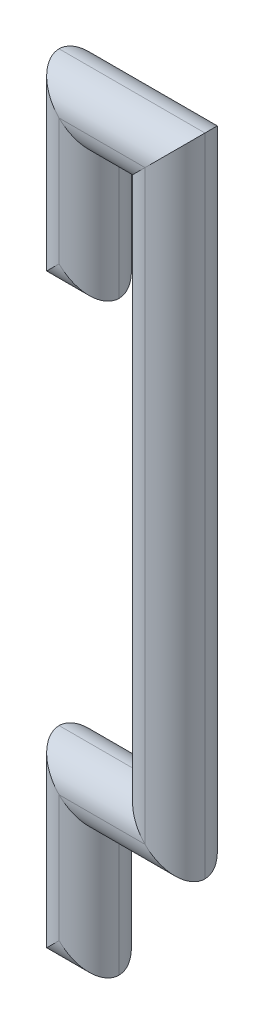
from build123d import *

# Parameters (mm, degrees)
EXTRU_MINCE1_DEPTH = 2.3
CONG_1_R           = 2.3


with BuildPart() as part:
    # Esquisse1 → Extru.-Mince1 (new, symmetric)
    with BuildSketch(Plane.XY):
        Polygon((-4.3, -57), (-4.3, -47.3), (2.3, -47.3), (2.3, 2.3), (-8.9, 2.3), (-8.9, -12), (-4.3, -12), (-4.3, -2.3), (-2.3, -2.3), (-2.3, -42.7), (-8.9, -42.7), (-8.9, -57), align=None)
    extrude(amount=EXTRU_MINCE1_DEPTH, both=True)

    # Congé1
    cong_1_edges = [part.edges().sort_by_distance(p)[0] for p in [
        (-6.6, -57, -2.3),
        (-4.3, -52.15, -2.3),
        (-1, -47.3, -2.3),
        (2.3, -22.5, -2.3),
        (-3.3, 2.3, -2.3),
        (-8.9, -4.85, -2.3),
        (-6.6, -12, -2.3),
        (-4.3, -7.15, -2.3),
        (-3.3, -2.3, -2.3),
        (-2.3, -22.5, -2.3),
        (-5.6, -42.7, -2.3),
        (-8.9, -49.85, -2.3),
        (-5.6, -42.7, 2.3),
        (-2.3, -22.5, 2.3),
        (-3.3, -2.3, 2.3),
        (-4.3, -7.15, 2.3),
        (-6.6, -12, 2.3),
        (-8.9, -4.85, 2.3),
        (-3.3, 2.3, 2.3),
        (2.3, -22.5, 2.3),
        (-1, -47.3, 2.3),
        (-4.3, -52.15, 2.3),
        (-6.6, -57, 2.3),
        (-8.9, -49.85, 2.3),
    ]]
    fillet(cong_1_edges, radius=CONG_1_R - 0.0001)  # a hair under: the kernel refuses the full size


solid = part.part
